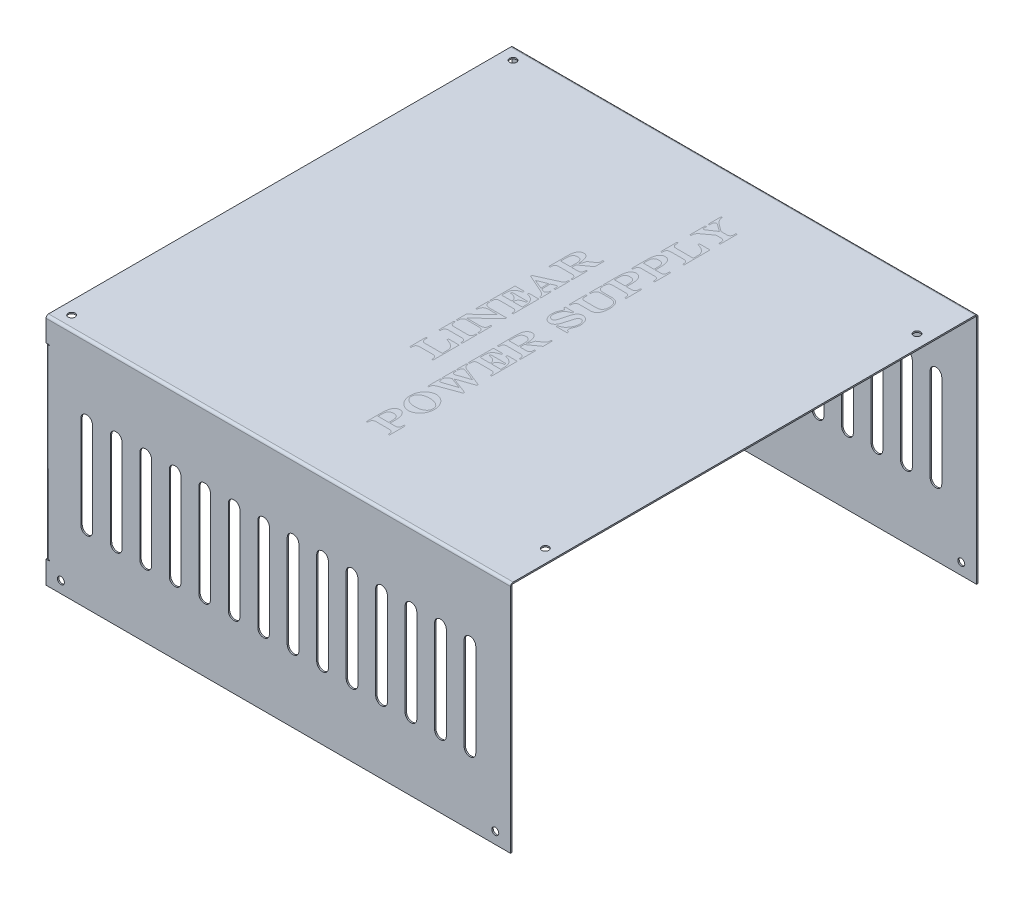
from build123d import *

# Parameters (mm, degrees)
BASE_FLANGE1_DEPTH            = 100
CUT_EXTRUDE1_DEPTH            = 10
LPATTERN1_COUNT               = 14
LPATTERN1_PITCH               = 12.692307692
LPATTERN3_COUNT               = 2
LPATTERN3_PITCH               = 200.6
LPATTERN3_COPY_1_DEPTH        = 10
LPATTERN3_COPY_2_DEPTH        = 10
LPATTERN3_COPY_3_DEPTH        = 10
LPATTERN3_COPY_4_DEPTH        = 10
LPATTERN3_COPY_5_DEPTH        = 10
LPATTERN3_COPY_6_DEPTH        = 10
LPATTERN3_COPY_7_DEPTH        = 10
LPATTERN3_COPY_8_DEPTH        = 10
LPATTERN3_COPY_9_DEPTH        = 10
LPATTERN3_COPY_10_DEPTH       = 10
LPATTERN3_COPY_11_DEPTH       = 10
LPATTERN3_COPY_12_DEPTH       = 10
LPATTERN3_COPY_13_DEPTH       = 10
EDGE_FLANGE1_STRIP_W          = 3.4
EDGE_FLANGE1_STRIP_H          = 0.6
EDGE_FLANGE1_STRIP_CUT_DEPTH  = 80
EDGE_FLANGE1_RELIEF_W         = 3.7
EDGE_FLANGE1_RELIEF_H         = 0.3
EDGE_FLANGE1_RELIEF_CUT_DEPTH = 0.6
EDGE_FLANGE1_DEPTH            = 80
FOLD1_START                   = 9.7
FOLD1_DEPTH                   = 80.6
FOLD1_2_DEPTH                 = 0.3
FOLD1_START_2                 = 90
FOLD1_3_DEPTH                 = 0.3
FOLD1_START_3                 = 10
FOLD1_4_DEPTH                 = 80
CUT_EXTRUDE2_REACH            = 247.684
SKETCH36_R                    = 1.5
FLAT_PATTERN1_OUTLINE_R       = 1.5
FLAT_PATTERN1_DEPTH           = 0.6
FLATTEN_BASEBEND1_1_START     = 100
FLATTEN_BASEBEND1_1_OUTLINE_R = 1.5
FLATTEN_BASEBEND1_1_DEPTH     = 0.6


# Read off the part's stored shape, not the designer's step: Fold1, Flat-Pattern1, Flatten-<BaseBend1>1
# Sheet-metal steps are written as plain solids
with BuildPart() as part:
    # Sketch2 → Base-Flange1 (new, symmetric)
    with BuildSketch(Plane(origin=(0, 0, 0), x_dir=(0, 0, -1), z_dir=(1, 0, 0))):
        with BuildLine():
            Line((0, 0), (0, 99.5))
            ThreePointArc((0, 99.5), (0.146446609, 99.853553391), (0.5, 100))
            Line((0.5, 100), (199.5, 100))
            ThreePointArc((199.5, 100), (199.853553391, 99.853553391), (200, 99.5))
            Line((200, 99.5), (200, 0))
            Line((200, 0), (200.6, 0))
            Line((200.6, 0), (200.6, 99.5))
            ThreePointArc((200.6, 99.5), (200.277817459, 100.277817459), (199.5, 100.6))
            Line((199.5, 100.6), (0.5, 100.6))
            ThreePointArc((0.5, 100.6), (-0.277817459, 100.277817459), (-0.6, 99.5))
            Line((-0.6, 99.5), (-0.6, 0))
            Line((-0.6, 0), (0, 0))
        make_face()
    extrude(amount=BASE_FLANGE1_DEPTH, both=True)

    # Sketch8 → Cut-Extrude1 (cut)
    with BuildSketch(Plane.XY.offset(0.6)):
        with BuildLine():
            Line((-80, 69.75), (-80, 29.75))
            ThreePointArc((-80, 29.75), (-82.5, 27.25), (-85, 29.75))
            Line((-85, 29.75), (-85, 69.75))
            ThreePointArc((-85, 69.75), (-82.5, 72.25), (-80, 69.75))
        make_face()
    cut_extrude1 = extrude(amount=-CUT_EXTRUDE1_DEPTH, mode=Mode.SUBTRACT)

    # LPattern1: Cut-Extrude1 ×14
    with Locations(*[(i * LPATTERN1_PITCH, 0, 0) for i in range(1, LPATTERN1_COUNT)]):
        add(cut_extrude1, mode=Mode.SUBTRACT)

    # LPattern3: Cut-Extrude1 ×2
    with Locations(*[(0, 0, -i * LPATTERN3_PITCH) for i in range(1, LPATTERN3_COUNT)]):
        add(cut_extrude1, mode=Mode.SUBTRACT)

    # LPattern3 copy 1 sketch → LPattern3 copy 1 (cut)
    with BuildSketch(Plane(origin=(12.692307692, 0, -200), x_dir=(1, 0, 0), z_dir=(0, 0, 1))):
        with BuildLine():
            Line((-80, 69.75), (-80, 29.75))
            ThreePointArc((-80, 29.75), (-82.5, 27.25), (-85, 29.75))
            Line((-85, 29.75), (-85, 69.75))
            ThreePointArc((-85, 69.75), (-82.5, 72.25), (-80, 69.75))
        make_face()
    extrude(amount=-LPATTERN3_COPY_1_DEPTH, mode=Mode.SUBTRACT)

    # LPattern3 copy 2 sketch → LPattern3 copy 2 (cut)
    with BuildSketch(Plane(origin=(25.384615385, 0, -200), x_dir=(1, 0, 0), z_dir=(0, 0, 1))):
        with BuildLine():
            Line((-80, 69.75), (-80, 29.75))
            ThreePointArc((-80, 29.75), (-82.5, 27.25), (-85, 29.75))
            Line((-85, 29.75), (-85, 69.75))
            ThreePointArc((-85, 69.75), (-82.5, 72.25), (-80, 69.75))
        make_face()
    extrude(amount=-LPATTERN3_COPY_2_DEPTH, mode=Mode.SUBTRACT)

    # LPattern3 copy 3 sketch → LPattern3 copy 3 (cut)
    with BuildSketch(Plane(origin=(38.076923077, 0, -200), x_dir=(1, 0, 0), z_dir=(0, 0, 1))):
        with BuildLine():
            Line((-80, 69.75), (-80, 29.75))
            ThreePointArc((-80, 29.75), (-82.5, 27.25), (-85, 29.75))
            Line((-85, 29.75), (-85, 69.75))
            ThreePointArc((-85, 69.75), (-82.5, 72.25), (-80, 69.75))
        make_face()
    extrude(amount=-LPATTERN3_COPY_3_DEPTH, mode=Mode.SUBTRACT)

    # LPattern3 copy 4 sketch → LPattern3 copy 4 (cut)
    with BuildSketch(Plane(origin=(50.769230769, 0, -200), x_dir=(1, 0, 0), z_dir=(0, 0, 1))):
        with BuildLine():
            Line((-80, 69.75), (-80, 29.75))
            ThreePointArc((-80, 29.75), (-82.5, 27.25), (-85, 29.75))
            Line((-85, 29.75), (-85, 69.75))
            ThreePointArc((-85, 69.75), (-82.5, 72.25), (-80, 69.75))
        make_face()
    extrude(amount=-LPATTERN3_COPY_4_DEPTH, mode=Mode.SUBTRACT)

    # LPattern3 copy 5 sketch → LPattern3 copy 5 (cut)
    with BuildSketch(Plane(origin=(63.461538462, 0, -200), x_dir=(1, 0, 0), z_dir=(0, 0, 1))):
        with BuildLine():
            Line((-80, 69.75), (-80, 29.75))
            ThreePointArc((-80, 29.75), (-82.5, 27.25), (-85, 29.75))
            Line((-85, 29.75), (-85, 69.75))
            ThreePointArc((-85, 69.75), (-82.5, 72.25), (-80, 69.75))
        make_face()
    extrude(amount=-LPATTERN3_COPY_5_DEPTH, mode=Mode.SUBTRACT)

    # LPattern3 copy 6 sketch → LPattern3 copy 6 (cut)
    with BuildSketch(Plane(origin=(76.153846154, 0, -200), x_dir=(1, 0, 0), z_dir=(0, 0, 1))):
        with BuildLine():
            Line((-80, 69.75), (-80, 29.75))
            ThreePointArc((-80, 29.75), (-82.5, 27.25), (-85, 29.75))
            Line((-85, 29.75), (-85, 69.75))
            ThreePointArc((-85, 69.75), (-82.5, 72.25), (-80, 69.75))
        make_face()
    extrude(amount=-LPATTERN3_COPY_6_DEPTH, mode=Mode.SUBTRACT)

    # LPattern3 copy 7 sketch → LPattern3 copy 7 (cut)
    with BuildSketch(Plane(origin=(88.846153846, 0, -200), x_dir=(1, 0, 0), z_dir=(0, 0, 1))):
        with BuildLine():
            Line((-80, 69.75), (-80, 29.75))
            ThreePointArc((-80, 29.75), (-82.5, 27.25), (-85, 29.75))
            Line((-85, 29.75), (-85, 69.75))
            ThreePointArc((-85, 69.75), (-82.5, 72.25), (-80, 69.75))
        make_face()
    extrude(amount=-LPATTERN3_COPY_7_DEPTH, mode=Mode.SUBTRACT)

    # LPattern3 copy 8 sketch → LPattern3 copy 8 (cut)
    with BuildSketch(Plane(origin=(101.538461538, 0, -200), x_dir=(1, 0, 0), z_dir=(0, 0, 1))):
        with BuildLine():
            Line((-80, 69.75), (-80, 29.75))
            ThreePointArc((-80, 29.75), (-82.5, 27.25), (-85, 29.75))
            Line((-85, 29.75), (-85, 69.75))
            ThreePointArc((-85, 69.75), (-82.5, 72.25), (-80, 69.75))
        make_face()
    extrude(amount=-LPATTERN3_COPY_8_DEPTH, mode=Mode.SUBTRACT)

    # LPattern3 copy 9 sketch → LPattern3 copy 9 (cut)
    with BuildSketch(Plane(origin=(114.230769231, 0, -200), x_dir=(1, 0, 0), z_dir=(0, 0, 1))):
        with BuildLine():
            Line((-80, 69.75), (-80, 29.75))
            ThreePointArc((-80, 29.75), (-82.5, 27.25), (-85, 29.75))
            Line((-85, 29.75), (-85, 69.75))
            ThreePointArc((-85, 69.75), (-82.5, 72.25), (-80, 69.75))
        make_face()
    extrude(amount=-LPATTERN3_COPY_9_DEPTH, mode=Mode.SUBTRACT)

    # LPattern3 copy 10 sketch → LPattern3 copy 10 (cut)
    with BuildSketch(Plane(origin=(126.923076923, 0, -200), x_dir=(1, 0, 0), z_dir=(0, 0, 1))):
        with BuildLine():
            Line((-80, 69.75), (-80, 29.75))
            ThreePointArc((-80, 29.75), (-82.5, 27.25), (-85, 29.75))
            Line((-85, 29.75), (-85, 69.75))
            ThreePointArc((-85, 69.75), (-82.5, 72.25), (-80, 69.75))
        make_face()
    extrude(amount=-LPATTERN3_COPY_10_DEPTH, mode=Mode.SUBTRACT)

    # LPattern3 copy 11 sketch → LPattern3 copy 11 (cut)
    with BuildSketch(Plane(origin=(139.615384615, 0, -200), x_dir=(1, 0, 0), z_dir=(0, 0, 1))):
        with BuildLine():
            Line((-80, 69.75), (-80, 29.75))
            ThreePointArc((-80, 29.75), (-82.5, 27.25), (-85, 29.75))
            Line((-85, 29.75), (-85, 69.75))
            ThreePointArc((-85, 69.75), (-82.5, 72.25), (-80, 69.75))
        make_face()
    extrude(amount=-LPATTERN3_COPY_11_DEPTH, mode=Mode.SUBTRACT)

    # LPattern3 copy 12 sketch → LPattern3 copy 12 (cut)
    with BuildSketch(Plane(origin=(152.307692308, 0, -200), x_dir=(1, 0, 0), z_dir=(0, 0, 1))):
        with BuildLine():
            Line((-80, 69.75), (-80, 29.75))
            ThreePointArc((-80, 29.75), (-82.5, 27.25), (-85, 29.75))
            Line((-85, 29.75), (-85, 69.75))
            ThreePointArc((-85, 69.75), (-82.5, 72.25), (-80, 69.75))
        make_face()
    extrude(amount=-LPATTERN3_COPY_12_DEPTH, mode=Mode.SUBTRACT)

    # LPattern3 copy 13 sketch → LPattern3 copy 13 (cut)
    with BuildSketch(Plane(origin=(165, 0, -200), x_dir=(1, 0, 0), z_dir=(0, 0, 1))):
        with BuildLine():
            Line((-80, 69.75), (-80, 29.75))
            ThreePointArc((-80, 29.75), (-82.5, 27.25), (-85, 29.75))
            Line((-85, 29.75), (-85, 69.75))
            ThreePointArc((-85, 69.75), (-82.5, 72.25), (-80, 69.75))
        make_face()
    extrude(amount=-LPATTERN3_COPY_13_DEPTH, mode=Mode.SUBTRACT)

    # Edge-Flange1 strip (across the edge) → Edge-Flange1 strip cut (cut)
    with BuildSketch(Plane(origin=(-100, 90, -200), x_dir=(1, 0, 0), z_dir=(0, -1, 0))):
        with Locations((-0.6, -0.3)):
            Rectangle(EDGE_FLANGE1_STRIP_W, EDGE_FLANGE1_STRIP_H)
    extrude(amount=EDGE_FLANGE1_STRIP_CUT_DEPTH, mode=Mode.SUBTRACT)

    # Edge-Flange1 relief (on the sheet) → Edge-Flange1 relief cut (cut)
    with BuildSketch(Plane(origin=(-98.9, 90, -200), x_dir=(1, 0, 0), z_dir=(0, 0, 1))):
        with Locations((-1.55, 0.15)):
            Rectangle(EDGE_FLANGE1_RELIEF_W, EDGE_FLANGE1_RELIEF_H)
        with Locations((-1.55, -80.15)):
            Rectangle(EDGE_FLANGE1_RELIEF_W, EDGE_FLANGE1_RELIEF_H)
    extrude(amount=-EDGE_FLANGE1_RELIEF_CUT_DEPTH, mode=Mode.SUBTRACT)

    # Edge-Flange1 section (across the edge) → Edge-Flange1 (add)
    with BuildSketch(Plane(origin=(-100, 90, -200), x_dir=(1, 0, 0), z_dir=(0, -1, 0))):
        with BuildLine():
            Line((0, 0.5), (0, 4))
            Line((0, 4), (0.6, 4))
            Line((0.6, 4), (0.6, 0.5))
            ThreePointArc((0.6, 0.5), (0.746446609, 0.146446609), (1.1, 0))
            Line((1.1, 0), (1.1, -0.6))
            ThreePointArc((1.1, -0.6), (0.322182541, -0.277817459), (0, 0.5))
        make_face()
    extrude(amount=EDGE_FLANGE1_DEPTH)

    # Fold1 outline → Fold1 (cut)
    with BuildSketch(Plane(origin=(0, 0, 0), x_dir=(1, 0, 0), z_dir=(0, 1, 0)).offset(FOLD1_START)):
        with BuildLine():
            ThreePointArc((-98.9, -0.6), (-99.474456264, -0.438083152), (-99.879795897, 0))
            Line((-99.879795897, 0), (-100, 0))
            Line((-100, 0), (-100, -0.6))
            Line((-100, -0.6), (-98.9, -0.6))
        make_face()
    extrude(amount=FOLD1_DEPTH, mode=Mode.SUBTRACT)

    # Fold1 2 outline → Fold1 2 (cut)
    with BuildSketch(Plane(origin=(0, 0, 0), x_dir=(1, 0, 0), z_dir=(0, 1, 0)).offset(FOLD1_START)):
        with BuildLine():
            Line((-98.6, 0), (-99.879795897, 0))
            ThreePointArc((-99.879795897, 0), (-99.474456264, -0.438083152), (-98.9, -0.6))
            Line((-98.9, -0.6), (-98.6, -0.6))
            Line((-98.6, -0.6), (-98.6, 0))
        make_face()
    extrude(amount=FOLD1_2_DEPTH, mode=Mode.SUBTRACT)

    # Fold1 3 outline → Fold1 3 (cut)
    with BuildSketch(Plane(origin=(0, 0, 0), x_dir=(1, 0, 0), z_dir=(0, 1, 0)).offset(FOLD1_START_2)):
        with BuildLine():
            Line((-98.6, 0), (-99.879795897, 0))
            ThreePointArc((-99.879795897, 0), (-99.474456264, -0.438083152), (-98.9, -0.6))
            Line((-98.9, -0.6), (-98.6, -0.6))
            Line((-98.6, -0.6), (-98.6, 0))
        make_face()
    extrude(amount=FOLD1_3_DEPTH, mode=Mode.SUBTRACT)

    # Fold1 4 outline → Fold1 4 (add)
    with BuildSketch(Plane(origin=(0, 0, 0), x_dir=(1, 0, 0), z_dir=(0, 1, 0)).offset(FOLD1_START_3)):
        with BuildLine():
            Line((-100, 4), (-100, 0.5))
            ThreePointArc((-100, 0.5), (-99.969526878, 0.242876962), (-99.879795897, 0))
            Line((-99.879795897, 0), (-98.9, 0))
            ThreePointArc((-98.9, 0), (-99.253553391, 0.146446609), (-99.4, 0.5))
            Line((-99.4, 0.5), (-99.4, 4))
            Line((-99.4, 4), (-100, 4))
        make_face()
    extrude(amount=FOLD1_4_DEPTH)

    # Sketch36 → Cut-Extrude2 (cut, up to next)
    with BuildSketch(Plane.XY.offset(-200), mode=Mode.PRIVATE) as cut_extrude2_sk1:
        with Locations((-93.6, 4.955087472)):
            Circle(SKETCH36_R)
    cut_extrude2_tool1 = extrude(cut_extrude2_sk1.sketch, amount=-CUT_EXTRUDE2_REACH, mode=Mode.PRIVATE) & part.part
    # Sketch36 → Cut-Extrude2 (cut, up to next)
    with BuildSketch(Plane.XY.offset(-200), mode=Mode.PRIVATE) as cut_extrude2_sk2:
        with Locations((93.4, 4.955087472)):
            Circle(SKETCH36_R)
    cut_extrude2_tool2 = extrude(cut_extrude2_sk2.sketch, amount=-CUT_EXTRUDE2_REACH, mode=Mode.PRIVATE) & part.part
    add(cut_extrude2_tool1.solids().sort_by_distance((-93.6, 4.955087, -200))[0], mode=Mode.SUBTRACT)
    add(cut_extrude2_tool2.solids().sort_by_distance((93.4, 4.955087, -200))[0], mode=Mode.SUBTRACT)

    # Flat-Pattern1 outline → Flat-Pattern1 (cut)
    with BuildSketch(Plane.XY):
        with Locations((93.4, 4.955087472)):
            Circle(FLAT_PATTERN1_OUTLINE_R)
        with Locations((-93.6, 4.955087472)):
            Circle(FLAT_PATTERN1_OUTLINE_R)
    extrude(amount=FLAT_PATTERN1_DEPTH, mode=Mode.SUBTRACT)

    # Flatten-<BaseBend1>1 outline → Flatten-<BaseBend1>1 (cut)
    with BuildSketch(Plane(origin=(0, 0, 0), x_dir=(1, 0, 0), z_dir=(0, 1, 0)).offset(FLATTEN_BASEBEND1_1_START)):
        with Locations((94.355087472, 20)):
            Circle(FLATTEN_BASEBEND1_1_OUTLINE_R)
        with Locations((94.355087472, 180)):
            Circle(FLATTEN_BASEBEND1_1_OUTLINE_R)
        with Locations((-94.555087472, 195)):
            Circle(FLATTEN_BASEBEND1_1_OUTLINE_R)
        with Locations((-94.555087472, 5)):
            Circle(FLATTEN_BASEBEND1_1_OUTLINE_R)
    extrude(amount=FLATTEN_BASEBEND1_1_DEPTH, mode=Mode.SUBTRACT)


solid = part.part
